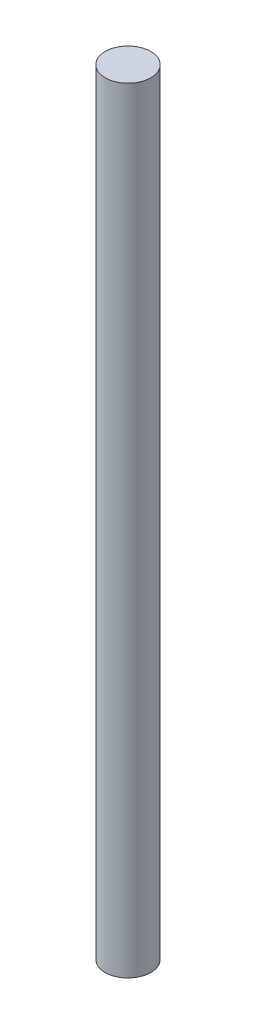
from build123d import *

# Parameters (mm, degrees)
SKETCH1_R           = 2.5
BOSS_EXTRUDE1_DEPTH = 42.45


with BuildPart() as part:
    # Sketch1 → Boss-Extrude1 (new, symmetric)
    with BuildSketch(Plane(origin=(0, 0, 0), x_dir=(1, 0, 0), z_dir=(0, 1, 0))):
        Circle(SKETCH1_R)
    extrude(amount=BOSS_EXTRUDE1_DEPTH, both=True)


solid = part.part
